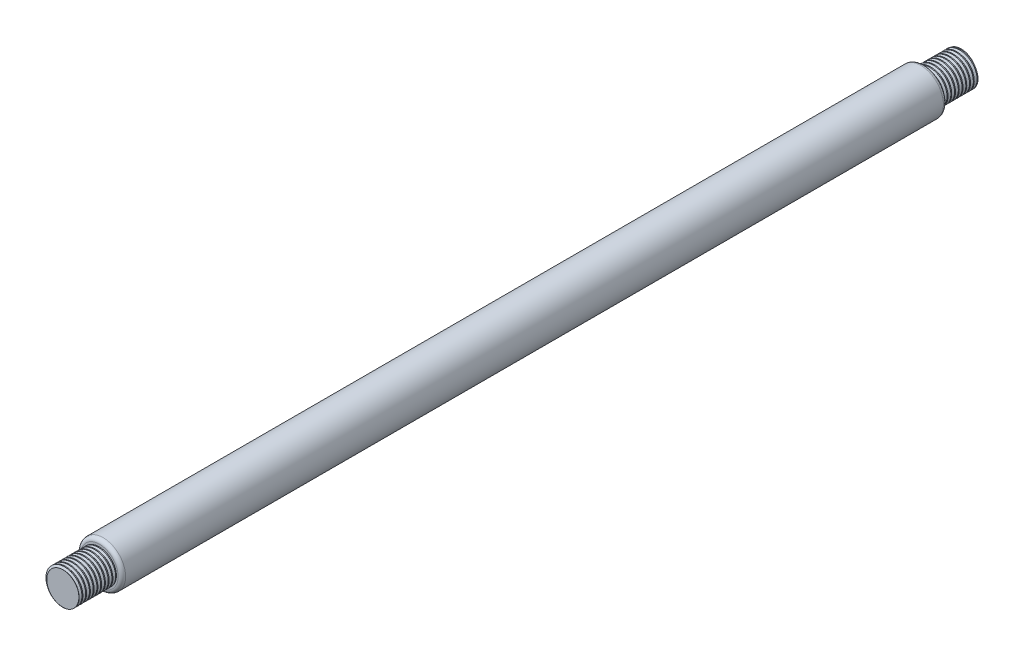
from build123d import *

# Parameters (mm, degrees)
THREAD1_PITCH     = 1
CIRPATTERN1_COUNT = 2
CIRPATTERN1_ANGLE = 180


with BuildPart() as part:
    # Sketch1 → Revolve1 (revolve)
    with BuildSketch(Plane(origin=(0, 0, 0), x_dir=(0, 0, -1), z_dir=(1, 0, 0)), mode=Mode.PRIVATE) as revolve1_sk:
        with BuildLine():
            Line((-58.378378378, -7.764478764), (61.621621622, -7.764478764))
            Line((61.621621622, -7.764478764), (61.621621622, -1.764478764))
            Line((61.621621622, -1.764478764), (-47.378378378, -1.764478764))
            ThreePointArc((-47.378378378, -1.764478764), (-48.08548516, -2.057371983), (-48.378378378, -2.764478764))
            Line((-48.378378378, -2.764478764), (-48.378378378, -3.514478764))
            ThreePointArc((-48.378378378, -3.514478764), (-48.451601683, -3.69125546), (-48.628378378, -3.764478764))
            Line((-48.628378378, -3.764478764), (-58.378378378, -3.764478764))
            Line((-58.378378378, -3.764478764), (-58.378378378, -7.764478764))
        make_face()
    revolve(revolve1_sk.sketch.rotate(Axis((0, -7.764478764, 58.378378378), (0, 0, -1)), 90), axis=Axis((0, -7.764478764, 58.378378378), (0, 0, -1)))

    # Thread1: the profile of Thread Profile1 profile screwed along a right-hand helix of 11 turns, 8 arcs to a turn; built about Z, then put on its axis
    thread1_z = Axis((0, 0, 0), (0, 0, 1))
    thread1_corners = [(3.9997, 0, -0.000173205), (3.9997, 0, 0.875173202), (4.541265875, 0, 0.562499998), (4.541265875, 0, 0.312499998)]
    with BuildLine(mode=Mode.PRIVATE) as thread1_profile:
        Line(thread1_corners[0], thread1_corners[1])
        Line(thread1_corners[1], thread1_corners[2])
        Line(thread1_corners[2], thread1_corners[3])
        Line(thread1_corners[3], thread1_corners[0])
    thread1_cap = Face(thread1_profile.wire())
    thread1_turn_angles = [0, 22.5, 45, 67.5, 90, 112.5, 135, 157.5, 180, 202.5, 225, 247.5, 270, 292.5, 315, 337.5, 360]
    thread1_turn_weights = [1, 0.9238795325112867, 1, 0.9238795325112867, 1, 0.9238795325112867, 1, 0.9238795325112867, 1, 0.9238795325112867, 1, 0.9238795325112867, 1, 0.9238795325112867, 1, 0.9238795325112867, 1]
    thread1_turn_rails = [Edge.make_bspline([Vector(p[0], p[1], 0).rotate(thread1_z, thread1_turn_angles[k]) / thread1_turn_weights[k] + Vector(0, 0, p[2] + THREAD1_PITCH * thread1_turn_angles[k] / 360) for k in range(17)], [0, 0, 0, 1, 1, 2, 2, 3, 3, 4, 4, 5, 5, 6, 6, 7, 7, 8, 8, 8], 2, thread1_turn_weights) for p in thread1_corners]
    thread1_turn_sides = [Face.make_surface_from_curves(thread1_turn_rails[p[0]], thread1_turn_rails[p[1]]) for p in [(0, 1), (1, 2), (2, 3), (3, 0)]]
    thread1 = Plane(origin=(0, -7.764478764, 59.378378378), x_dir=(-1, 0, 0), z_dir=(0, 0, -1)) * Solid(Shell([*[p.moved(Location((0, 0, THREAD1_PITCH * i))) for i in range(11) for p in thread1_turn_sides], thread1_cap, thread1_cap.rotate(thread1_z, 3960).moved(Location((0, 0, THREAD1_PITCH * 3960 / 360)))]))
    add(thread1)

    # SurfaceCut2
    split(bisect_by=Plane(origin=(0, 0, 58.378378378), x_dir=(-1, 0, 0), z_dir=(0, 0, -1)), keep=Keep.TOP)


with BuildPart() as cirpattern1_1:
    # CirPattern1: pattern copy
    add(part.part.rotate(Axis((0, -7.764478764, -61.621621622), (0, 1, 0)), 1 * CIRPATTERN1_ANGLE / (CIRPATTERN1_COUNT - 1)))


with BuildPart() as part_1:
    add(part.part)

    # Combine1: union CirPattern1_1
    add(cirpattern1_1.part)


solid = part_1.part
